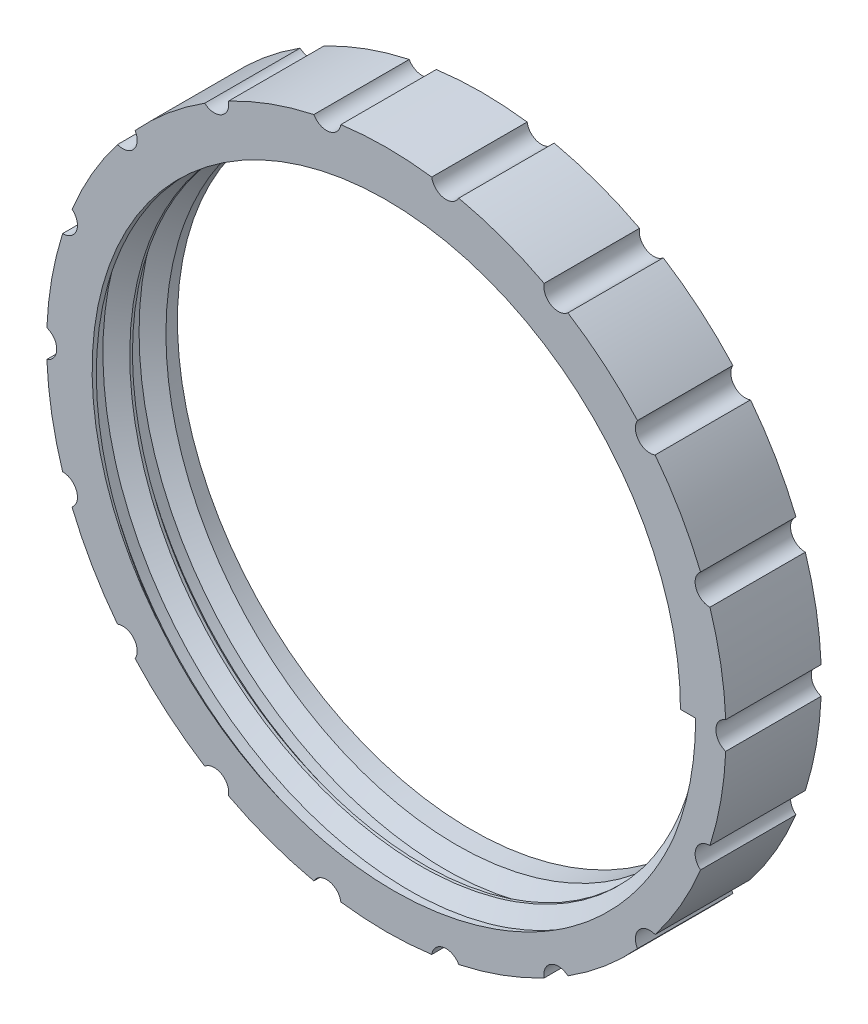
from build123d import *

# Parameters (mm, degrees)
GRIP_RING_D47_START                  = -0.2
SKETCH1_R                            = 23.5
SKETCH1_R_2                          = 20.35
GRIP_RING_D47_DEPTH                  = 6.6
LOWER_FEMALE_D42_P2P5_PITCH          = 2.5
GRIP_FLUTES_START                    = -0.2
SKETCH3_R                            = 1
GRIP_FLUTES_DEPTH                    = 6.6
HAND_START_THREAD_ENTRY_RELIEF_START = -0.21
SKETCH4_R                            = 21.4
HAND_START_THREAD_ENTRY_RELIEF_DEPTH = 0.71


with BuildPart() as part:
    # Sketch1 → Grip_ring_D47 (new body)
    with BuildSketch(Plane.XY.offset(GRIP_RING_D47_START)):
        Circle(SKETCH1_R)
        Circle(SKETCH1_R_2, mode=Mode.SUBTRACT)
    extrude(amount=GRIP_RING_D47_DEPTH)

    # Lower_female_D42_P2p5: the profile of 3DSketch1 screwed along a right-hand helix of 2 turns, 10 arcs to a turn; built about Z, then put on its axis
    lower_female_d42_p2p5_z = Axis((0, 0, 0), (0, 0, 1))
    lower_female_d42_p2p5_corners = [(20.1, 0, -1.35), (21.4, 0, -0.35), (21.4, 0, 0.35), (20.1, 0, 1.35)]
    with BuildLine(mode=Mode.PRIVATE) as lower_female_d42_p2p5_profile:
        Line(lower_female_d42_p2p5_corners[0], lower_female_d42_p2p5_corners[1])
        Line(lower_female_d42_p2p5_corners[1], lower_female_d42_p2p5_corners[2])
        Line(lower_female_d42_p2p5_corners[2], lower_female_d42_p2p5_corners[3])
        Line(lower_female_d42_p2p5_corners[3], lower_female_d42_p2p5_corners[0])
    lower_female_d42_p2p5_cap = Face(lower_female_d42_p2p5_profile.wire())
    lower_female_d42_p2p5_turn_angles = [0, 18, 36, 54, 72, 90, 108, 126, 144, 162, 180, 198, 216, 234, 252, 270, 288, 306, 324, 342, 360]
    lower_female_d42_p2p5_turn_weights = [1, 0.9510565162951535, 1, 0.9510565162951535, 1, 0.9510565162951535, 1, 0.9510565162951535, 1, 0.9510565162951535, 1, 0.9510565162951535, 1, 0.9510565162951535, 1, 0.9510565162951535, 1, 0.9510565162951535, 1, 0.9510565162951535, 1]
    lower_female_d42_p2p5_turn_rails = [Edge.make_bspline([Vector(p[0], p[1], 0).rotate(lower_female_d42_p2p5_z, lower_female_d42_p2p5_turn_angles[k]) / lower_female_d42_p2p5_turn_weights[k] + Vector(0, 0, p[2] + LOWER_FEMALE_D42_P2P5_PITCH * lower_female_d42_p2p5_turn_angles[k] / 360) for k in range(21)], [0, 0, 0, 1, 1, 2, 2, 3, 3, 4, 4, 5, 5, 6, 6, 7, 7, 8, 8, 9, 9, 10, 10, 10], 2, lower_female_d42_p2p5_turn_weights) for p in lower_female_d42_p2p5_corners]
    lower_female_d42_p2p5_turn_sides = [Face.make_surface_from_curves(lower_female_d42_p2p5_turn_rails[p[0]], lower_female_d42_p2p5_turn_rails[p[1]]) for p in [(0, 1), (1, 2), (2, 3), (3, 0)]]
    lower_female_d42_p2p5 = Plane(origin=(0, 0, 1.2), x_dir=(1, 0, 0), z_dir=(0, 0, 1)) * Solid(Shell([*[p.moved(Location((0, 0, LOWER_FEMALE_D42_P2P5_PITCH * i))) for i in range(2) for p in lower_female_d42_p2p5_turn_sides], lower_female_d42_p2p5_cap, lower_female_d42_p2p5_cap.rotate(lower_female_d42_p2p5_z, 720).moved(Location((0, 0, LOWER_FEMALE_D42_P2P5_PITCH * 720 / 360)))]))
    add(lower_female_d42_p2p5, mode=Mode.SUBTRACT)

    # Sketch3 → Grip_flutes (cut)
    with BuildSketch(Plane.XY.offset(GRIP_FLUTES_START)):
        with Locations((23.8, 0)):
            Circle(SKETCH3_R)
        with Locations((22.364684375, 8.140079411)):
            Circle(SKETCH3_R)
        with Locations((18.231857746, 15.298345111)):
            Circle(SKETCH3_R)
        with Locations((11.9, 20.61140461)):
            Circle(SKETCH3_R)
        with Locations((4.132826628, 23.438424522)):
            Circle(SKETCH3_R)
        with Locations((-4.132826628, 23.438424522)):
            Circle(SKETCH3_R)
        with Locations((-11.9, 20.61140461)):
            Circle(SKETCH3_R)
        with Locations((-18.231857746, 15.298345111)):
            Circle(SKETCH3_R)
        with Locations((-22.364684375, 8.140079411)):
            Circle(SKETCH3_R)
        with Locations((-23.8, 0)):
            Circle(SKETCH3_R)
        with Locations((-22.364684375, -8.140079411)):
            Circle(SKETCH3_R)
        with Locations((-18.231857746, -15.298345111)):
            Circle(SKETCH3_R)
        with Locations((-11.9, -20.61140461)):
            Circle(SKETCH3_R)
        with Locations((-4.132826628, -23.438424522)):
            Circle(SKETCH3_R)
        with Locations((4.132826628, -23.438424522)):
            Circle(SKETCH3_R)
        with Locations((11.9, -20.61140461)):
            Circle(SKETCH3_R)
        with Locations((18.231857746, -15.298345111)):
            Circle(SKETCH3_R)
        with Locations((22.364684375, -8.140079411)):
            Circle(SKETCH3_R)
    extrude(amount=GRIP_FLUTES_DEPTH, mode=Mode.SUBTRACT)

    # Sketch4 → Hand_start_thread_entry_relief (cut)
    with BuildSketch(Plane.XY.offset(HAND_START_THREAD_ENTRY_RELIEF_START)):
        with Locations(Location((0, 0, 0), (0, 0, 180))):
            Circle(SKETCH4_R)
    extrude(amount=HAND_START_THREAD_ENTRY_RELIEF_DEPTH, mode=Mode.SUBTRACT)


solid = part.part
